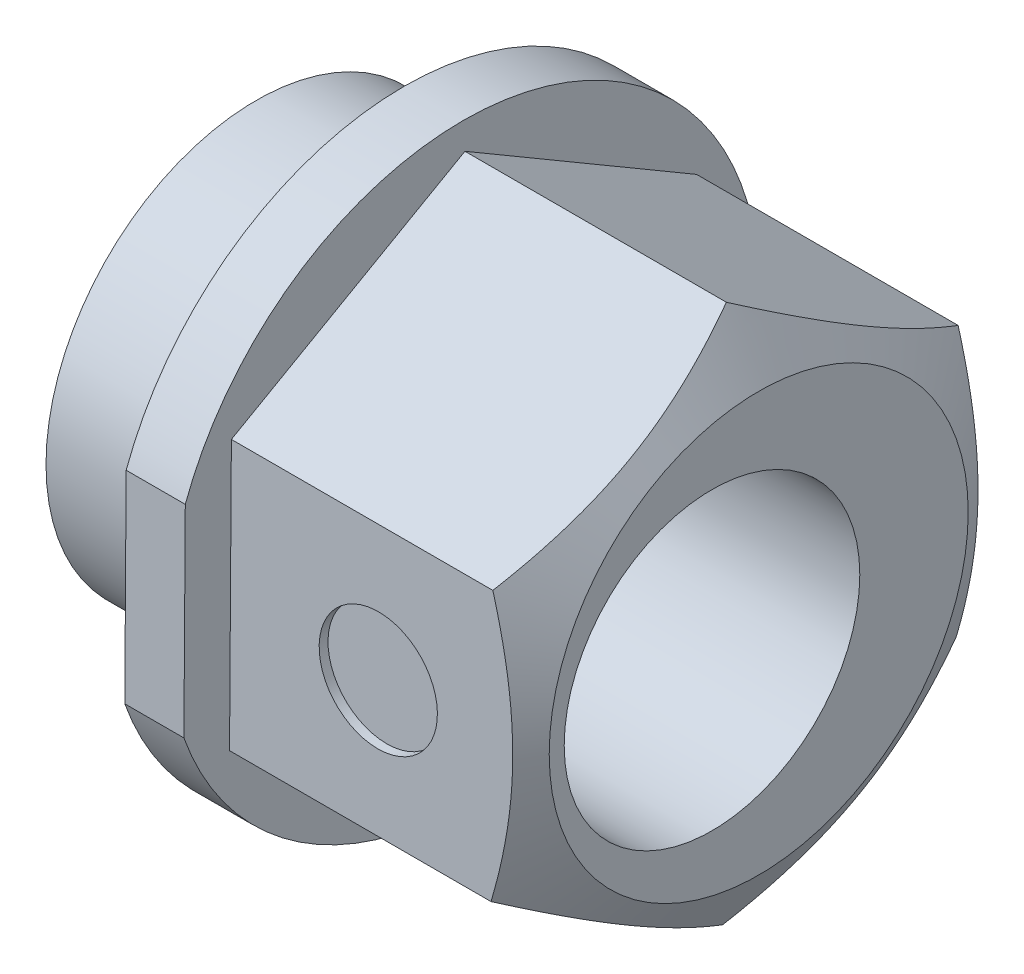
from build123d import *

# Parameters (mm, degrees)
BOSS_EXTRUDE1_DEPTH = 5
BOSS_EXTRUDE3_DEPTH = 1
SKETCH4_R           = 3.555
BOSS_EXTRUDE4_DEPTH = 2.5
SKETCH5_R           = 1
CUT_EXTRUDE3_DEPTH  = 0.15
SKETCH3_R           = 2.5
CUT_EXTRUDE5_DEPTH  = 12.065721847


with BuildPart() as part:
    # Sketch2 → Boss-Extrude1 (new body)
    with BuildSketch(Plane(origin=(0, 0, 0), x_dir=(0, 0, -1), z_dir=(1, 0, 0))):
        Polygon((3.919437566, -2.29861752), (3.950379949, 2.245023741), (0.030942383, 4.54364126), (-3.919437566, 2.29861752), (-3.950379949, -2.245023741), (-0.030942383, -4.54364126), align=None)
    extrude(amount=BOSS_EXTRUDE1_DEPTH)

    # Sketch6 → Boss-Extrude3 (add)
    with BuildSketch(Plane.ZY):
        with BuildLine():
            Line((4.699218, 1.737080939), (4.71082912, 0.032080939))
            Line((4.71082912, 0.032080939), (4.722440239, -1.672919061))
            ThreePointArc((4.722440239, -1.672919061), (-5.009883831, -0.034117514), (4.699218, 1.737080939))
        make_face()
    extrude(amount=BOSS_EXTRUDE3_DEPTH)

    # Sketch4 → Boss-Extrude4 (add)
    with BuildSketch(Plane.ZY.offset(1)):
        Circle(SKETCH4_R)
    extrude(amount=BOSS_EXTRUDE4_DEPTH)

    # Sketch5 → Cut-Extrude3 (cut)
    with BuildSketch(Plane(origin=(0, 0.02679689, 3.934908757), x_dir=(1, 0, 0), z_dir=(0, -0.006809882993303443, -0.9999768124779782))):
        with Locations((2.5, 0)):
            Circle(SKETCH5_R)
    extrude(amount=CUT_EXTRUDE3_DEPTH, mode=Mode.SUBTRACT)

    # Sketch3 → Cut-Extrude5 (cut, through all)
    with BuildSketch(Plane.ZY.offset(3.5)):
        with Locations((0.79, 0)):
            Circle(SKETCH3_R)
    extrude(amount=-CUT_EXTRUDE5_DEPTH, mode=Mode.SUBTRACT)

    # Sketch7 → Cut-Revolve1 (revolve, cut)
    with BuildSketch(Plane.XY):
        Polygon((4.422649731, 4.54364126), (5, 3.54364126), (9.422649731, 3.54364126), (9.422649731, 8.54364126), (4.422649731, 8.54364126), align=None)
    revolve(axis=Axis((0, 0, 0), (1, 0, 0)), mode=Mode.SUBTRACT)


solid = part.part
